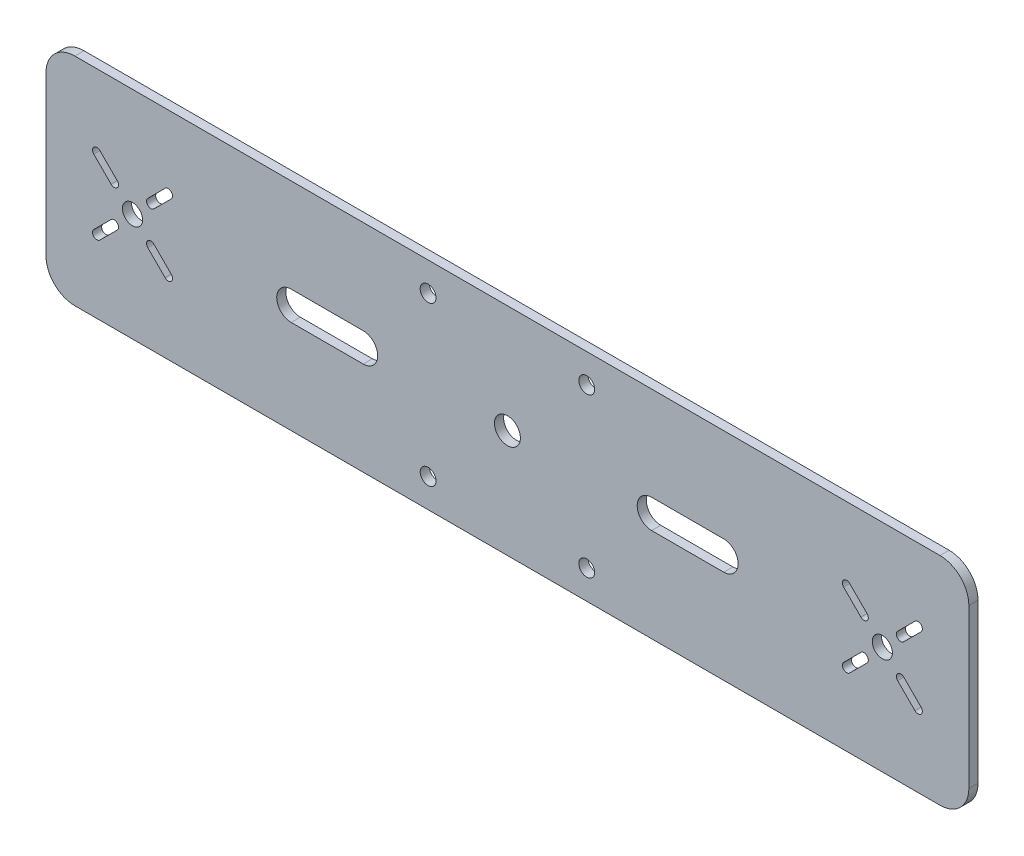
from build123d import *

# Parameters (mm, degrees)
SKETCH1_W                       = 320
SKETCH1_H                       = 75
SKETCH1_R                       = 4.5
SKETCH1_R_2                     = 2.75
SKETCH1_R_3                     = 3.5
BOSS_EXTRUDE1_DEPTH             = 3.175
MOUNTING_AND_ACCESS_HOLES_DEPTH = 356.015056899
FILLET1_R                       = 10


with BuildPart() as part:
    # Sketch1 → Boss-Extrude1 (new body)
    with BuildSketch(Plane.XY.offset(151.125)):
        with Locations((0, 279.4)):
            Rectangle(SKETCH1_W, SKETCH1_H)
        with Locations((0, 279.4)):
            Circle(SKETCH1_R, mode=Mode.SUBTRACT)
        with Locations((27.5, 251.9)):
            Circle(SKETCH1_R_2, mode=Mode.SUBTRACT)
        with Locations((-27.5, 251.9)):
            Circle(SKETCH1_R_2, mode=Mode.SUBTRACT)
        with Locations((-27.5, 306.9)):
            Circle(SKETCH1_R_2, mode=Mode.SUBTRACT)
        with Locations((27.5, 306.9)):
            Circle(SKETCH1_R_2, mode=Mode.SUBTRACT)
        with Locations((130, 279.4)):
            Circle(SKETCH1_R_3, mode=Mode.SUBTRACT)
        with Locations((-130, 279.4)):
            Circle(SKETCH1_R_3, mode=Mode.SUBTRACT)
    extrude(amount=BOSS_EXTRUDE1_DEPTH)

    # Sketch2 → Mounting and Access Holes (cut, symmetric)
    with BuildSketch(Plane.XY.offset(154.3)):
        with BuildLine():
            Line((-124.696699141, 286.824621202), (-118.686291501, 292.835028843))
            ThreePointArc((-118.686291501, 292.835028843), (-116.564971157, 292.835028843), (-116.564971157, 290.713708499))
            Line((-116.564971157, 290.713708499), (-122.575378798, 284.703300859))
            ThreePointArc((-122.575378798, 284.703300859), (-124.696699141, 284.703300859), (-124.696699141, 286.824621202))
        make_face()
        with BuildLine():
            Line((-135.303300859, 286.824621202), (-141.313708499, 292.835028843))
            ThreePointArc((-141.313708499, 292.835028843), (-143.435028843, 292.835028843), (-143.435028843, 290.713708499))
            Line((-143.435028843, 290.713708499), (-137.424621202, 284.703300859))
            ThreePointArc((-137.424621202, 284.703300859), (-135.303300859, 284.703300859), (-135.303300859, 286.824621202))
        make_face()
        with BuildLine():
            Line((-137.424621202, 274.096699141), (-143.435028843, 268.086291501))
            ThreePointArc((-143.435028843, 268.086291501), (-143.435028843, 265.964971157), (-141.313708499, 265.964971157))
            Line((-141.313708499, 265.964971157), (-135.303300859, 271.975378798))
            ThreePointArc((-135.303300859, 271.975378798), (-135.303300859, 274.096699141), (-137.424621202, 274.096699141))
        make_face()
        with BuildLine():
            Line((-124.696699141, 271.975378798), (-118.686291501, 265.964971157))
            ThreePointArc((-118.686291501, 265.964971157), (-116.564971157, 265.964971157), (-116.564971157, 268.086291501))
            Line((-116.564971157, 268.086291501), (-122.575378798, 274.096699141))
            ThreePointArc((-122.575378798, 274.096699141), (-124.696699141, 274.096699141), (-124.696699141, 271.975378798))
        make_face()
        with BuildLine():
            Line((-50, 274.4), (-75, 274.4))
            ThreePointArc((-75, 274.4), (-80, 279.4), (-75, 284.4))
            Line((-75, 284.4), (-50, 284.4))
            ThreePointArc((-50, 284.4), (-45, 279.4), (-50, 274.4))
        make_face()
    mounting_and_access_holes = extrude(amount=MOUNTING_AND_ACCESS_HOLES_DEPTH, both=True, mode=Mode.SUBTRACT)

    # Mirror1: Mounting and Access Holes across plane
    add(mounting_and_access_holes.mirror(Plane(origin=(0, 0, 0), x_dir=(0, 0, 1), z_dir=(1, 0, 0))), mode=Mode.SUBTRACT)

    # Fillet1
    fillet1_edges = [part.edges().sort_by_distance(p)[0] for p in [
        (-160, 316.9, 152.7125),
        (-160, 241.9, 152.7125),
        (160, 241.9, 152.7125),
        (160, 316.9, 152.7125),
    ]]
    fillet(fillet1_edges, radius=FILLET1_R)


solid = part.part
